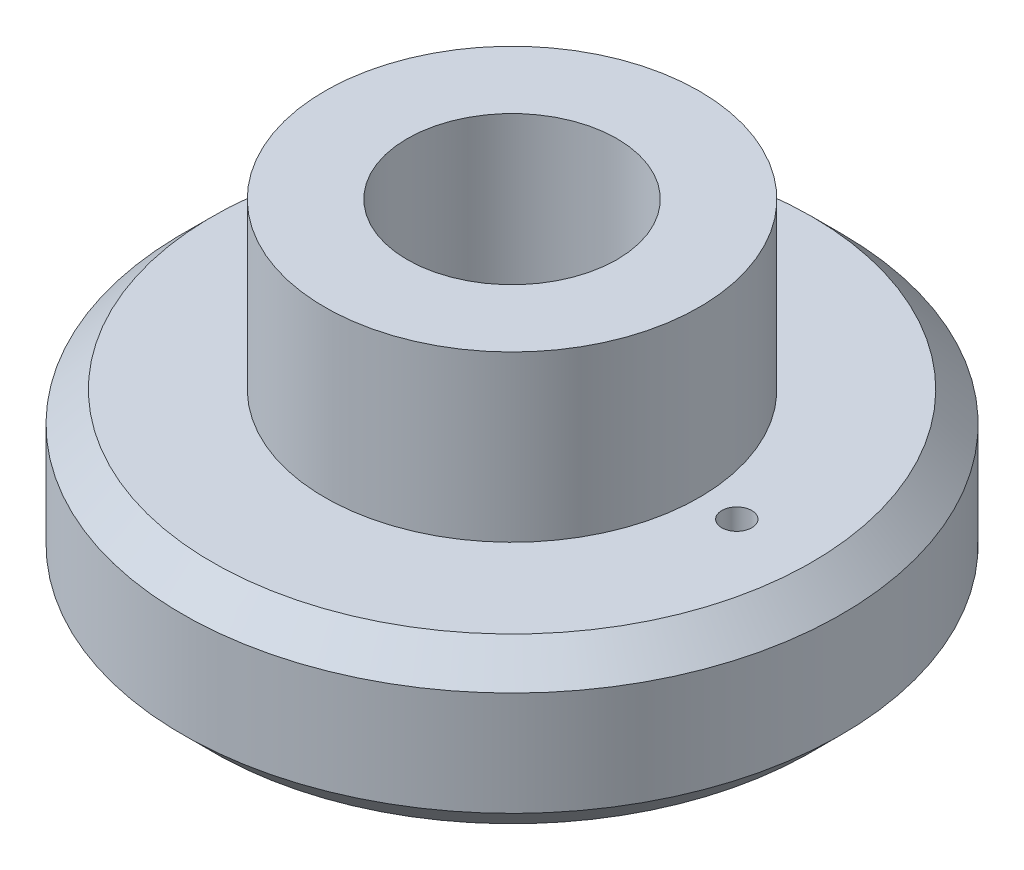
from build123d import *

# Parameters (mm, degrees)
SKETCH_4_R          = 1
CUT_EXTRUDE_2_DEPTH = 34.000133333


with BuildPart() as part:
    # Эскиз1 → Revolve 1 (revolve)
    with BuildSketch(Plane.XY):
        Polygon((7, 22), (7, 0), (17.5, 0), (17.5, 11), (12.5, 11), (12.5, 22), align=None)
    revolve(axis=Axis((0, 0, 0), (0, 1, 0)))

    # Эскиз3 → Revolve 1 2 (revolve)
    with BuildSketch(Plane.XY):
        Polygon((17.4999, 0), (17.4999, 11), (20.000041421, 11), (22.0001, 8.999941421), (22.0001, 2.04399768), (19.95610232, 0), align=None)
        Polygon((17.5, 0.0001), (17.5, 10.9999), (20, 10.9999), (22, 8.9999), (22, 2.044039102), (19.956060898, 0.0001), align=None, mode=Mode.SUBTRACT)
    revolve(axis=Axis((0, 0, 0), (0, 1, 0)))

    # Эскиз4 → Вырез-Вытянуть2 (cut, through all)
    with BuildSketch(Plane(origin=(0, 11, 0), x_dir=(1, 0, 0), z_dir=(0, 1, 0))):
        with Locations((-15, 0)):
            Circle(SKETCH_4_R)
        with Locations((15, 0)):
            Circle(SKETCH_4_R)
    extrude(amount=-CUT_EXTRUDE_2_DEPTH, mode=Mode.SUBTRACT)


solid = part.part
